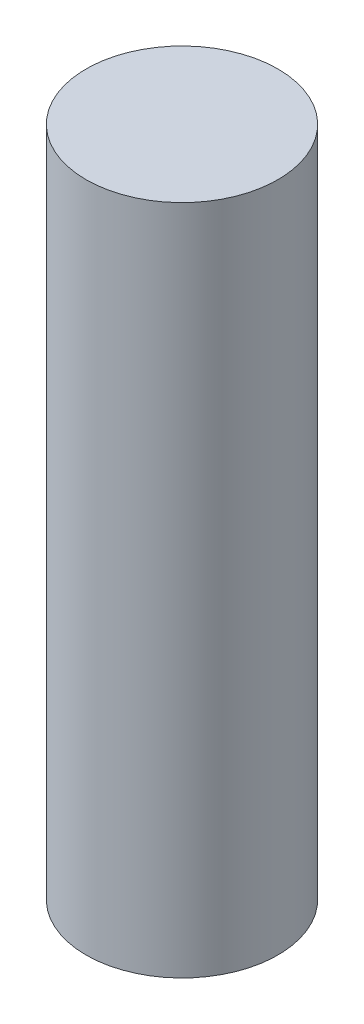
from build123d import *
from build123d.topology import SkipClean

# Parameters (mm, degrees)
SKETCH1_R           = 5
BOSS_EXTRUDE1_DEPTH = 35
CUT_EXTRUDE1_DEPTH  = 22
SKETCH3_R           = 2.5
CUT_EXTRUDE2_DEPTH  = 4


with BuildPart() as part:
    # Sketch1 → Boss-Extrude1 (new body)
    with BuildSketch(Plane(origin=(0, 0, 0), x_dir=(1, 0, 0), z_dir=(0, 1, 0))):
        Circle(SKETCH1_R)
    extrude(amount=BOSS_EXTRUDE1_DEPTH)

    # Sketch2 → Cut-Extrude1 (cut)
    with BuildSketch(Plane.XZ):
        with BuildLine():
            Line((-1.5, 2), (1.5, 2))
            ThreePointArc((1.5, 2), (0, -2.5), (-1.5, 2))
        make_face()
    extrude(amount=-CUT_EXTRUDE1_DEPTH, mode=Mode.SUBTRACT)

    # Sketch3 → Cut-Extrude2 (cut)
    with SkipClean():  # the faces are left unmerged after this step: merging them gives an invalid solid
        with BuildSketch(Plane.XZ):
            Circle(SKETCH3_R)
        extrude(amount=-CUT_EXTRUDE2_DEPTH, mode=Mode.SUBTRACT)


solid = part.part
